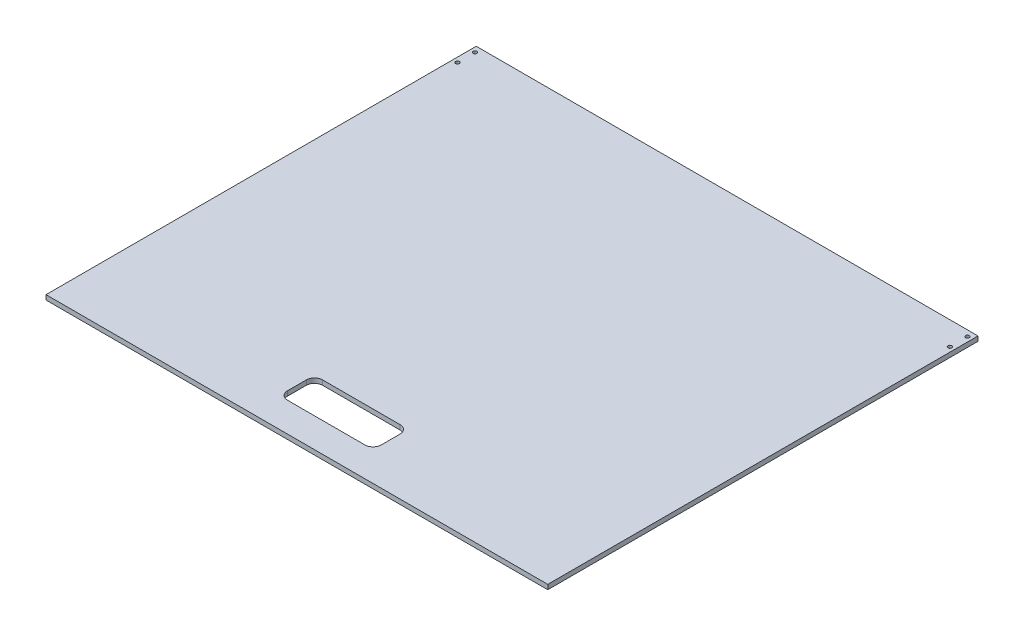
from build123d import *

# Parameters (mm, degrees)
SKETCH1_W           = 428
SKETCH1_H           = 367
BOSS_EXTRUDE1_DEPTH = 4
SKETCH2_R           = 1.6
CUT_EXTRUDE1_DEPTH  = 282.929512467
CUT_EXTRUDE2_DEPTH  = 282.929512467


with BuildPart() as part:
    # Sketch1 → Boss-Extrude1 (new body)
    with BuildSketch(Plane(origin=(0, 0, 0), x_dir=(1, 0, 0), z_dir=(0, 1, 0))):
        Rectangle(SKETCH1_W, SKETCH1_H)
    extrude(amount=BOSS_EXTRUDE1_DEPTH)

    # Sketch2 → Cut-Extrude1 (cut, through all)
    with BuildSketch(Plane.XZ):
        with Locations((210, -163.5)):
            Circle(SKETCH2_R)
        with Locations((210, -178.5)):
            Circle(SKETCH2_R)
    cut_extrude1 = extrude(amount=-CUT_EXTRUDE1_DEPTH, mode=Mode.SUBTRACT)

    # Mirror1: Cut-Extrude1 across plane
    add(cut_extrude1.mirror(Plane(origin=(0, 0, 0), x_dir=(0, 0, 1), z_dir=(1, 0, 0))), mode=Mode.SUBTRACT)

    # Sketch3 → Cut-Extrude2 (cut, through all)
    with BuildSketch(Plane(origin=(0, 4, 0), x_dir=(1, 0, 0), z_dir=(0, 1, 0))):
        with BuildLine():
            Line((-33, -158.5), (33, -158.5))
            ThreePointArc((33, -158.5), (37.949747468, -156.449747468), (40, -151.5))
            Line((40, -151.5), (40, -135.5))
            ThreePointArc((40, -135.5), (37.949747468, -130.550252532), (33, -128.5))
            Line((33, -128.5), (-33, -128.5))
            ThreePointArc((-33, -128.5), (-37.949747468, -130.550252532), (-40, -135.5))
            Line((-40, -135.5), (-40, -151.5))
            ThreePointArc((-40, -151.5), (-37.949747468, -156.449747468), (-33, -158.5))
        make_face()
    extrude(amount=-CUT_EXTRUDE2_DEPTH, mode=Mode.SUBTRACT)


solid = part.part
